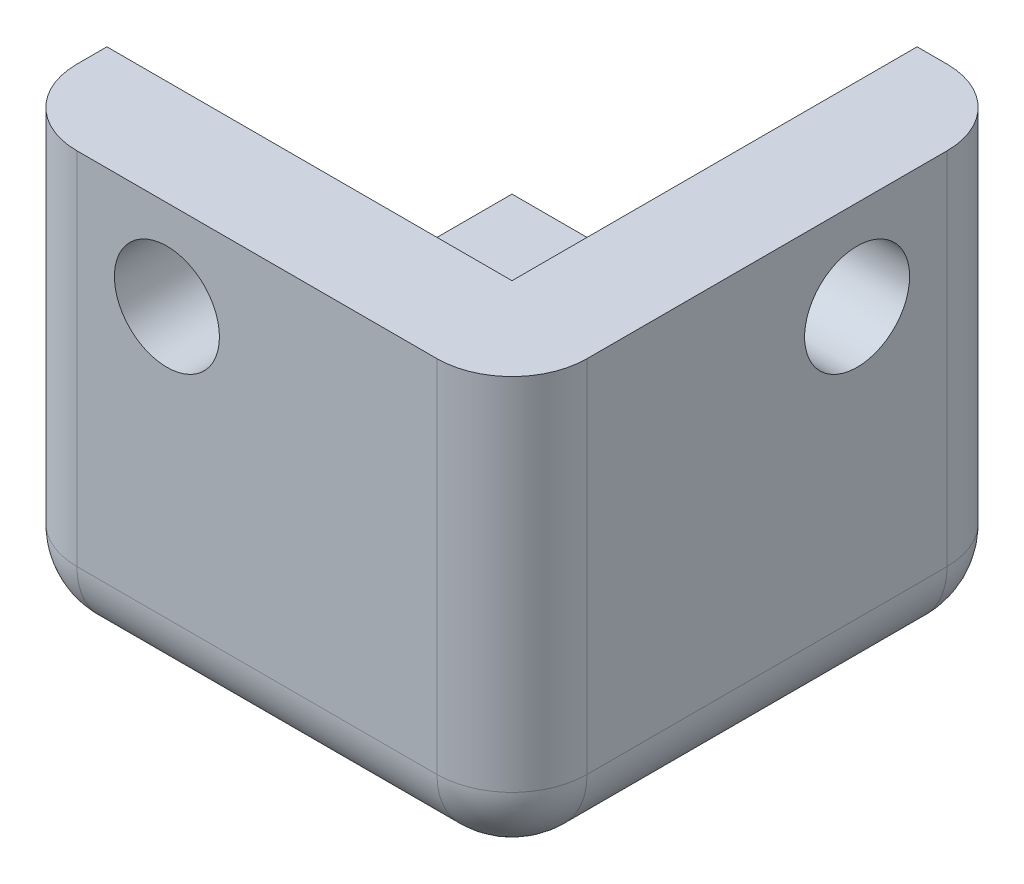
from build123d import *

# Parameters (mm, degrees)
SALIENTE_EXTRUIR1_DEPTH = 22
CROQUIS2_W              = 34
CROQUIS2_H              = 34
SALIENTE_EXTRUIR2_DEPTH = 7
REDONDEO1_R             = 5
CROQUIS3_R              = 3.5
CORTAR_EXTRUIR1_DEPTH   = 5
CROQUIS4_R              = 2
CORTAR_EXTRUIR2_DEPTH   = 5
CROQUIS5_R              = 3.5
CORTAR_EXTRUIR3_DEPTH   = 5
CROQUIS6_R              = 2
CORTAR_EXTRUIR4_DEPTH   = 5
REDONDEO2_R             = 5


with BuildPart() as part:
    # Croquis1 → Saliente-Extruir1 (new body)
    with BuildSketch(Plane(origin=(0, 0, 0), x_dir=(1, 0, 0), z_dir=(0, 1, 0))):
        Polygon((0, 0), (27, 0), (27, 27), (34, 27), (34, -7), (0, -7), align=None)
    extrude(amount=SALIENTE_EXTRUIR1_DEPTH)

    # Croquis2 → Saliente-Extruir2 (add)
    with BuildSketch(Plane(origin=(0, 0, 0), x_dir=(-1, 0, 0), z_dir=(0, -1, 0))):
        with Locations((-17, 10)):
            Rectangle(CROQUIS2_W, CROQUIS2_H)
    extrude(amount=SALIENTE_EXTRUIR2_DEPTH)

    # Redondeo1
    redondeo1_edges = [part.edges().sort_by_distance(p)[0] for p in [
        (34, 7.5, -27),
        (34, 7.5, 7),
        (0, 7.5, 7),
        (34, -7, -10),
        (17, -7, 7),
    ]]
    fillet(redondeo1_edges, radius=REDONDEO1_R)

    # Croquis3 → Cortar-Extruir1 (cut)
    with BuildSketch(Plane(origin=(34, 0, 0), x_dir=(0, 0, -1), z_dir=(1, 0, 0))):
        with Locations((16, 16)):
            Circle(CROQUIS3_R)
    extrude(amount=-CORTAR_EXTRUIR1_DEPTH, mode=Mode.SUBTRACT)

    # Croquis4 → Cortar-Extruir2 (cut)
    with BuildSketch(Plane(origin=(29, 0, 0), x_dir=(0, 0, -1), z_dir=(1, 0, 0))):
        with Locations((16, 16)):
            Circle(CROQUIS4_R)
    extrude(amount=-CORTAR_EXTRUIR2_DEPTH, mode=Mode.SUBTRACT)

    # Croquis5 → Cortar-Extruir3 (cut)
    with BuildSketch(Plane.XY.offset(7)):
        with Locations((11, 16)):
            Circle(CROQUIS5_R)
    extrude(amount=-CORTAR_EXTRUIR3_DEPTH, mode=Mode.SUBTRACT)

    # Croquis6 → Cortar-Extruir4 (cut)
    with BuildSketch(Plane.XY.offset(2)):
        with Locations((11, 16)):
            Circle(CROQUIS6_R)
    extrude(amount=-CORTAR_EXTRUIR4_DEPTH, mode=Mode.SUBTRACT)

    # Redondeo2
    # the kernel refuses this fillet: 5 mm, written as the material it takes off along each edge
    with BuildSketch(Plane(origin=(29, -2, -22), x_dir=(0, -1, 0), z_dir=(0, 0, -1))) as redondeo2_piece_1_section:
        Polygon((0, 0), (REDONDEO2_R, 0), (REDONDEO2_R, -REDONDEO2_R), (0, -REDONDEO2_R), align=None)
    redondeo2_piece_1 = extrude(amount=REDONDEO2_R, mode=Mode.PRIVATE)
    redondeo2_piece_1 = redondeo2_piece_1 - Plane(origin=(29, -2, -22), x_dir=(-0.7071067811865475, 0.7071067811865475, 0), z_dir=(0, 0, -1)) * Sphere(REDONDEO2_R, mode=Mode.PRIVATE)
    add(redondeo2_piece_1, mode=Mode.SUBTRACT)
    with BuildSketch(Plane(origin=(5, -2, 2), x_dir=(0, -1, 0), z_dir=(-1, 0, 0))) as redondeo2_piece_2_section:
        Polygon((0, 0), (REDONDEO2_R, 0), (REDONDEO2_R, REDONDEO2_R), (0, REDONDEO2_R), align=None)
    redondeo2_piece_2 = extrude(amount=REDONDEO2_R, mode=Mode.PRIVATE)
    redondeo2_piece_2 = redondeo2_piece_2 - Plane(origin=(5, -2, 2), x_dir=(0, 0.7071067811865475, -0.7071067811865475), z_dir=(-1, 0, 0)) * Sphere(REDONDEO2_R, mode=Mode.PRIVATE)
    add(redondeo2_piece_2, mode=Mode.SUBTRACT)
    with BuildSketch(Plane(origin=(-12.5, -7, -27), x_dir=(0, 1, 0), z_dir=(1, 0, 0)), Plane(origin=(0, -7, 2), x_dir=(0, 1, 0), z_dir=(0, 0, -1))) as redondeo2_piece_3:
        with BuildLine():
            CenterArc((REDONDEO2_R, REDONDEO2_R), REDONDEO2_R, 180, 90)
            Line((0, REDONDEO2_R), (0, 0))
            Line((0, 0), (REDONDEO2_R, 0))
        make_face()
    extrude(amount=41.5, mode=Mode.SUBTRACT)


solid = part.part
